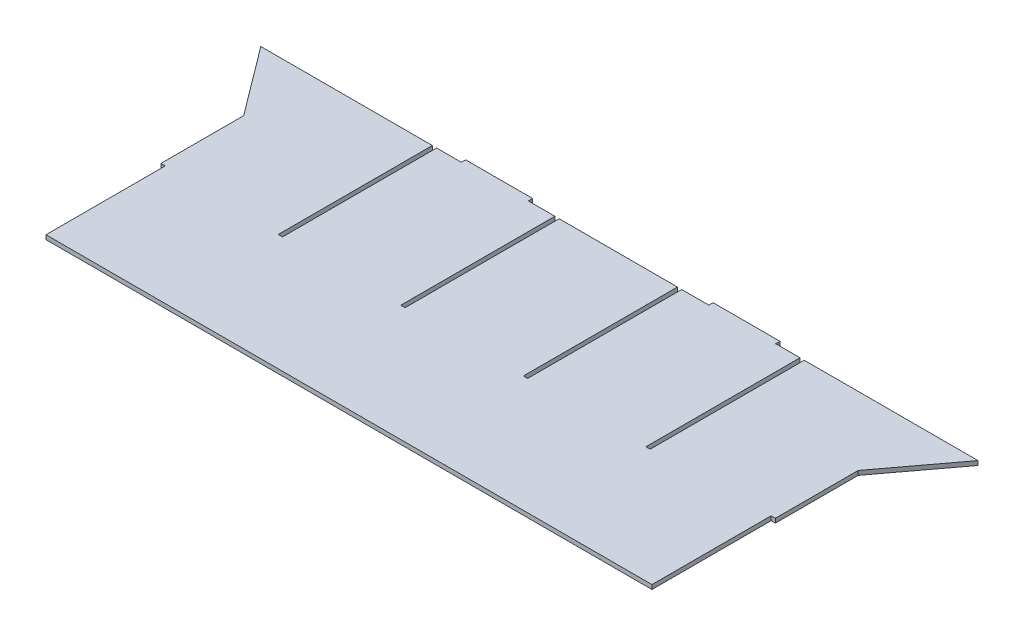
from build123d import *

# Parameters (mm, degrees)
SKETCH1_W           = 455.9320066
SKETCH1_H           = 3.175
BOSS_EXTRUDE1_DEPTH = 200.6419914
SKETCH2_W           = 3.175
SKETCH2_H           = 114.3
CUT_EXTRUDE1_DEPTH  = 304.703454044
LPATTERN1_COUNT     = 4
LPATTERN1_PITCH     = 90.932
SKETCH3_W           = 49.658811606
SKETCH3_H           = 3.175
BOSS_EXTRUDE2_DEPTH = 3.175
BOSS_EXTRUDE3_DEPTH = 3.175
SKETCH5_W           = 3.175
SKETCH5_H           = 88.392
CUT_EXTRUDE2_DEPTH  = 3.175


with BuildPart() as part:
    # Sketch1 → Boss-Extrude1 (new body)
    with BuildSketch(Plane.XY):
        Rectangle(SKETCH1_W, SKETCH1_H)
    extrude(amount=BOSS_EXTRUDE1_DEPTH)

    # Sketch2 → Cut-Extrude1 (cut, through all)
    with BuildSketch(Plane(origin=(0, 1.5875, 0), x_dir=(1, 0, 0), z_dir=(0, 1, 0))):
        with Locations((135.5735033, -57.15)):
            Rectangle(SKETCH2_W, SKETCH2_H)
    cut_extrude1 = extrude(amount=-CUT_EXTRUDE1_DEPTH, mode=Mode.SUBTRACT)

    # LPattern1: Cut-Extrude1 ×4
    with Locations(*[(-i * LPATTERN1_PITCH, 0, 0) for i in range(1, LPATTERN1_COUNT)]):
        add(cut_extrude1, mode=Mode.SUBTRACT)

    # Sketch3 → Boss-Extrude2 (add)
    with BuildSketch(Plane(origin=(0, 0, 0), x_dir=(-1, 0, 0), z_dir=(0, 0, -1))):
        with Locations((-91.136597497, 0)):
            Rectangle(SKETCH3_W, SKETCH3_H)
        with Locations((92.427590897, 0)):
            Rectangle(SKETCH3_W, SKETCH3_H)
    extrude(amount=BOSS_EXTRUDE2_DEPTH)

    # Sketch4 → Boss-Extrude3 (add)
    with BuildSketch(Plane.XZ.offset(1.5875)):
        Polygon((-227.9660033, 0), (-266.0660033, 0), (-227.9660033, 50.8), align=None)
    boss_extrude3 = extrude(amount=-BOSS_EXTRUDE3_DEPTH)

    # Mirror1: Boss-Extrude3 across plane
    add(boss_extrude3.mirror(Plane(origin=(0, 0, 0), x_dir=(0, 0, 1), z_dir=(1, 0, 0))))

    # Sketch5 → Cut-Extrude2 (cut)
    with BuildSketch(Plane.XZ.offset(1.5875)):
        with Locations((-226.3785033, 156.4459914)):
            Rectangle(SKETCH5_W, SKETCH5_H)
    cut_extrude2 = extrude(amount=-CUT_EXTRUDE2_DEPTH, mode=Mode.SUBTRACT)

    # Mirror2: Cut-Extrude2 across plane
    add(cut_extrude2.mirror(Plane(origin=(0, 0, 0), x_dir=(0, 0, 1), z_dir=(1, 0, 0))), mode=Mode.SUBTRACT)


solid = part.part
